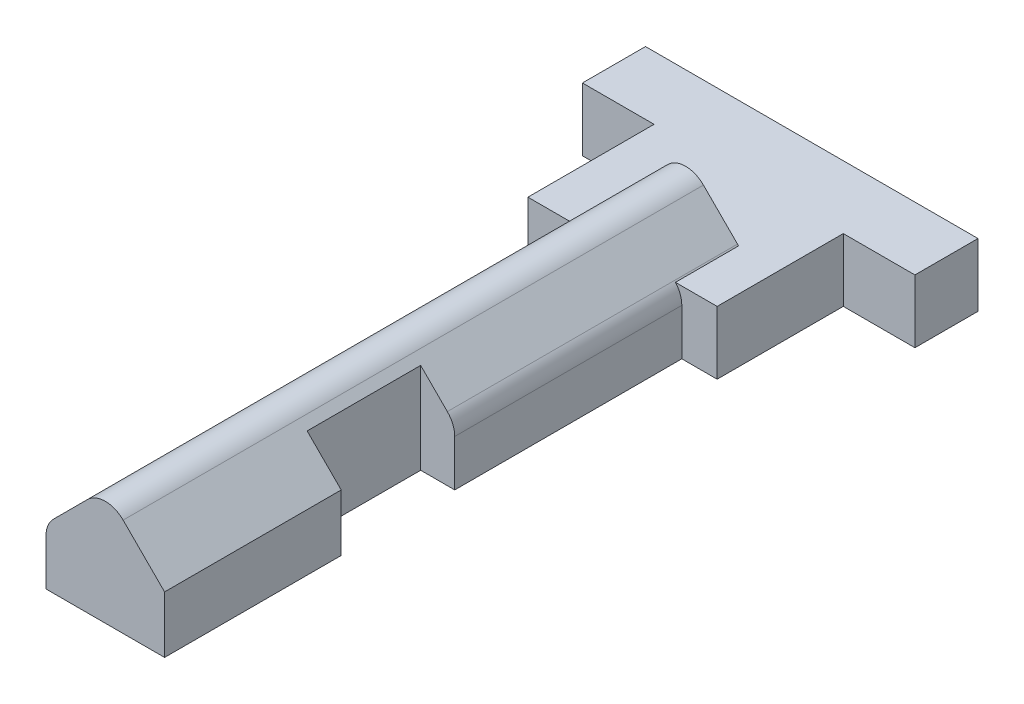
from build123d import *

# Parameters (mm, degrees)
DODANIE_WYCI_GNI_CIE1_DEPTH = 46
SZKIC2_W                    = 8
SZKIC2_H                    = 9
WYTNIJ_WYCI_GNI_CIE1_DEPTH  = 10
DODANIE_WYCI_GNI_CIE2_DEPTH = 5
ZAOKR_GLENIE1_R             = 2


with BuildPart() as part:
    # Szkic1 → Dodanie-wyciągnięcie1 (new body)
    with BuildSketch(Plane.XY):
        Polygon((0, 6.95), (-4.7, 2.25), (-4.7, -2.25), (4.7, -2.25), (4.7, 2.25), align=None)
    extrude(amount=DODANIE_WYCI_GNI_CIE1_DEPTH)

    # Szkic2 → Wytnij-wyciągnięcie1 (cut)
    with BuildSketch(Plane.XZ.offset(2.25)):
        with Locations((6, 27.5)):
            Rectangle(SZKIC2_W, SZKIC2_H)
    extrude(amount=-WYTNIJ_WYCI_GNI_CIE1_DEPTH, mode=Mode.SUBTRACT)

    # Szkic4 → Dodanie-wyciągnięcie2 (add)
    with BuildSketch(Plane.XZ.offset(2.25)):
        Polygon((13.178116647, -5), (7.5, -5), (7.5, 5), (-7.5, 5), (-7.5, -5), (-13.178116647, -5), (-13.178116647, -10), (13.178116647, -10), align=None)
    extrude(amount=-DODANIE_WYCI_GNI_CIE2_DEPTH)

    # Zaokrąglenie1
    zaokr_glenie1_edges = [part.edges().sort_by_distance(p)[0] for p in [
        (4.7, 2.25, 14),
        (-4.7, 2.25, 25.5),
        (0, 6.95, 23),
    ]]
    fillet(zaokr_glenie1_edges, radius=ZAOKR_GLENIE1_R)


solid = part.part
